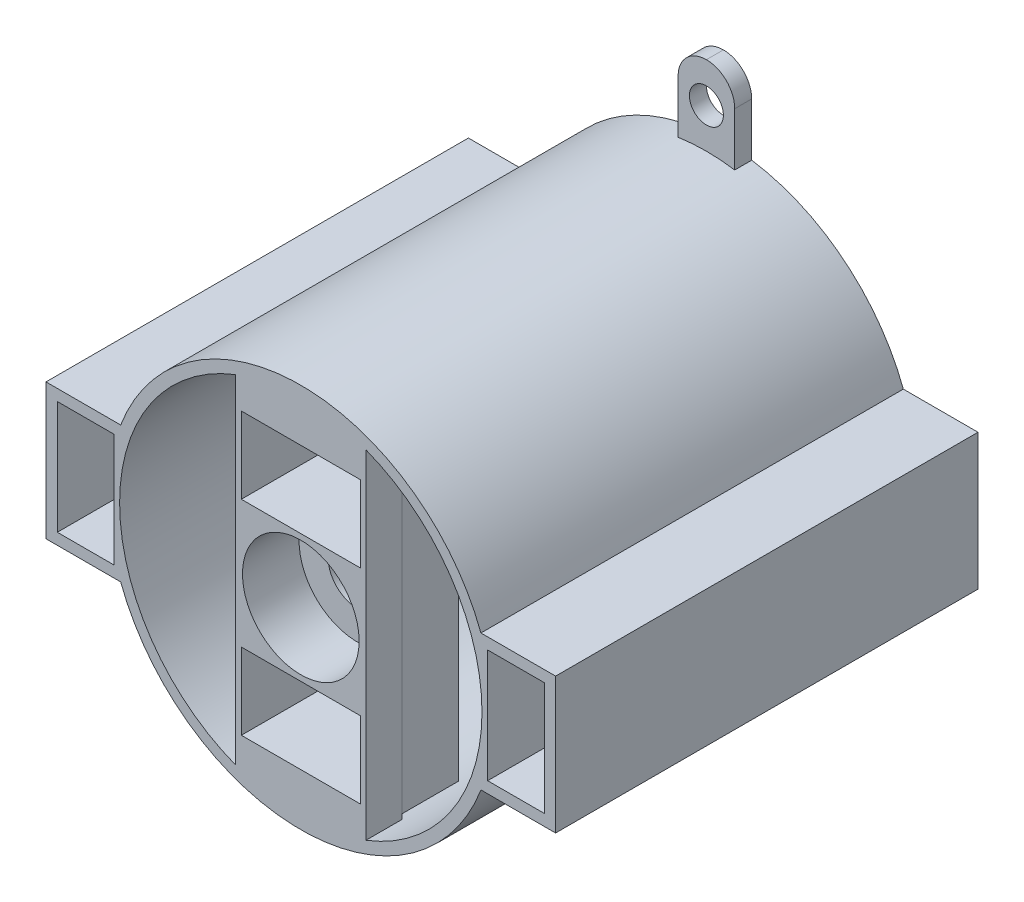
from build123d import *

# Parameters (mm, degrees)
SKETCH1_R               = 17
SKETCH1_R_2             = 16
BOSS_EXTRUDE1_DEPTH     = 37.3
BOSS_EXTRUDE3_START     = -3.175
SKETCH4_W               = 11.5
SKETCH4_H               = 11.5
BOSS_EXTRUDE3_DEPTH     = 3.175
SKETCH8_W               = 11.49524473
SKETCH8_H               = 29.000689646
SKETCH8_R               = 2.5875
BOSS_EXTRUDE4_DEPTH     = 5
CUT_EXTRUDE2_DEPTH      = 45.376683067
CUT_EXTRUDE2_DEPTH_BACK = 5
SKETCH7_R               = 5.15
SKETCH11_W              = 10.5
SKETCH11_H              = 6.75
CUT_EXTRUDE21_DEPTH     = 29
BOSS_EXTRUDE5_START     = -1.5
BOSS_EXTRUDE5_OUTLINE_R = 1.5
BOSS_EXTRUDE5_DEPTH     = 1.5
FILLET1_R               = 2.5
FILLET1_OF_MIRROR3_R    = 2.5
BOSS_EXTRUDE8_DEPTH     = 37.3
SKETCH15_8_W            = 5
SKETCH15_8_H            = 10
CUT_EXTRUDE22_DEPTH     = 37.3


# Read off the part's stored shape, not the designer's step: Boss-Extrude5
with BuildPart() as part:
    # Sketch1 → Boss-Extrude1 (new body)
    with BuildSketch(Plane.XY):
        with Locations(Location((0, 0, 0), (0, 0, 359.325928118))):
            Circle(SKETCH1_R)
        Circle(SKETCH1_R_2, mode=Mode.SUBTRACT)
    extrude(amount=BOSS_EXTRUDE1_DEPTH)

    # Sketch4 → Boss-Extrude3 (add)
    with BuildSketch(Plane.XY.offset(37.3).offset(BOSS_EXTRUDE3_START)):
        with BuildLine():
            ThreePointArc((-5.75, -14.931091722), (0, -16), (5.75, -14.931091722))
            Line((5.75, -14.931091722), (5.75, -5.75))
            Line((5.75, -5.75), (-5.75, -5.75))
            Line((-5.75, -5.75), (-5.75, -14.931091722))
        make_face()
        Rectangle(SKETCH4_W, SKETCH4_H)
        with BuildLine():
            ThreePointArc((5.75, 14.931091722), (0, 16), (-5.75, 14.931091722))
            Line((-5.75, 14.931091722), (-5.75, 5.75))
            Line((-5.75, 5.75), (5.75, 5.75))
            Line((5.75, 5.75), (5.75, 14.931091722))
        make_face()
    extrude(amount=BOSS_EXTRUDE3_DEPTH)

    # Sketch8 → Boss-Extrude4 (add)
    with BuildSketch(Plane.XY.offset(34.125)):
        Rectangle(SKETCH8_W, SKETCH8_H)
        Circle(SKETCH8_R, mode=Mode.SUBTRACT)
    extrude(amount=-BOSS_EXTRUDE4_DEPTH)

    # Sketch7 → Cut-Extrude2 (cut, two sides: drawn at the far end of the back side and taken through both)
    with BuildSketch(Plane.XY.offset(37.3).offset(-CUT_EXTRUDE2_DEPTH_BACK)):
        Circle(SKETCH7_R)
    extrude(amount=CUT_EXTRUDE2_DEPTH + CUT_EXTRUDE2_DEPTH_BACK, mode=Mode.SUBTRACT)

    # Sketch11 → Cut-Extrude21 (cut)
    with BuildSketch(Plane(origin=(0, 0, 37.3), x_dir=(-1, 0, 0), z_dir=(0, 0, -1))):
        with Locations((0, 9.025)):
            Rectangle(SKETCH11_W, SKETCH11_H)
    cut_extrude21 = extrude(amount=CUT_EXTRUDE21_DEPTH, mode=Mode.SUBTRACT)

    # Mirror1: Cut-Extrude21 across plane
    add(cut_extrude21.mirror(Plane.ZX), mode=Mode.SUBTRACT)

    # Boss-Extrude5 outline → Boss-Extrude5 (add)
    with BuildSketch(Plane(origin=(0, 0, 0), x_dir=(-1, 0, 0), z_dir=(0, 0, -1)).offset(BOSS_EXTRUDE5_START)):
        with BuildLine():
            ThreePointArc((-2.517959329, 16.812491809), (-0.018156734, 16.999990304), (2.482040671, 16.817832028))
            Line((2.482040671, 16.817832028), (2.482040671, 24))
            Line((2.482040671, 24), (-2.517959329, 24))
            Line((-2.517959329, 24), (-2.517959329, 16.812491809))
        make_face()
        with Locations((-0.017959329, 20.5)):
            Circle(BOSS_EXTRUDE5_OUTLINE_R, mode=Mode.SUBTRACT)
    boss_extrude5 = extrude(amount=BOSS_EXTRUDE5_DEPTH)

    # Fillet1
    fillet1_edges = [part.edges().sort_by_distance(p)[0] for p in [
        (2.517959329, 24, 0.75),
        (-2.482040671, 24, 0.75),
    ]]
    fillet(fillet1_edges, radius=FILLET1_R - 0.0001)  # a hair under: the kernel refuses the full size

    # Mirror3: Boss-Extrude5 across plane
    add(boss_extrude5.mirror(Plane.ZX))

    # Fillet1 of Mirror3
    fillet1_of_mirror3_edges = [part.edges().sort_by_distance(p)[0] for p in [
        (2.517959329, -24, 0.75),
        (-2.482040671, -24, 0.75),
    ]]
    fillet(fillet1_of_mirror3_edges, radius=FILLET1_OF_MIRROR3_R - 0.0001)  # a hair under: the kernel refuses the full size

    # Sketch15 → Boss-Extrude8 (add)
    with BuildSketch(Plane.XY):
        with BuildLine():
            Line((16.5, 5), (19, 5))
            Line((19, 5), (19, 6))
            Line((19, 6), (15.5, 6))
            Line((15.5, 6), (15.5, 3.968626967))
            ThreePointArc((15.5, 3.968626967), (15.874507866, 2), (16, 0))
            Line((16, 0), (16.5, 0))
            Line((16.5, 0), (16.5, 5))
        make_face()
        Polygon((21.5, 5), (21.5, 0), (22.5, 0), (22.5, 6), (19, 6), (19, 5), align=None)
        with BuildLine():
            Line((22.5, 0), (21.5, 0))
            Line((21.5, 0), (21.5, -5))
            Line((21.5, -5), (16.5, -5))
            Line((16.5, -5), (16.5, 0))
            Line((16.5, 0), (16, 0))
            ThreePointArc((16, 0), (15.874507866, -2), (15.5, -3.968626967))
            Line((15.5, -3.968626967), (15.5, -6))
            Line((15.5, -6), (22.5, -6))
            Line((22.5, -6), (22.5, 0))
        make_face()
    boss_extrude8 = extrude(amount=BOSS_EXTRUDE8_DEPTH)

    # Sketch15<8> → Cut-Extrude22 (cut)
    with BuildSketch(Plane.XY):
        with Locations((19, 0)):
            Rectangle(SKETCH15_8_W, SKETCH15_8_H)
    cut_extrude22 = extrude(amount=CUT_EXTRUDE22_DEPTH, mode=Mode.SUBTRACT)

    # Mirror4: Boss-Extrude8, Cut-Extrude22 across plane
    add(boss_extrude8.mirror(Plane(origin=(0, 0, 0), x_dir=(0, 0, 1), z_dir=(1, 0, 0))))
    add(cut_extrude22.mirror(Plane(origin=(0, 0, 0), x_dir=(0, 0, 1), z_dir=(1, 0, 0))), mode=Mode.SUBTRACT)


solid = part.part
